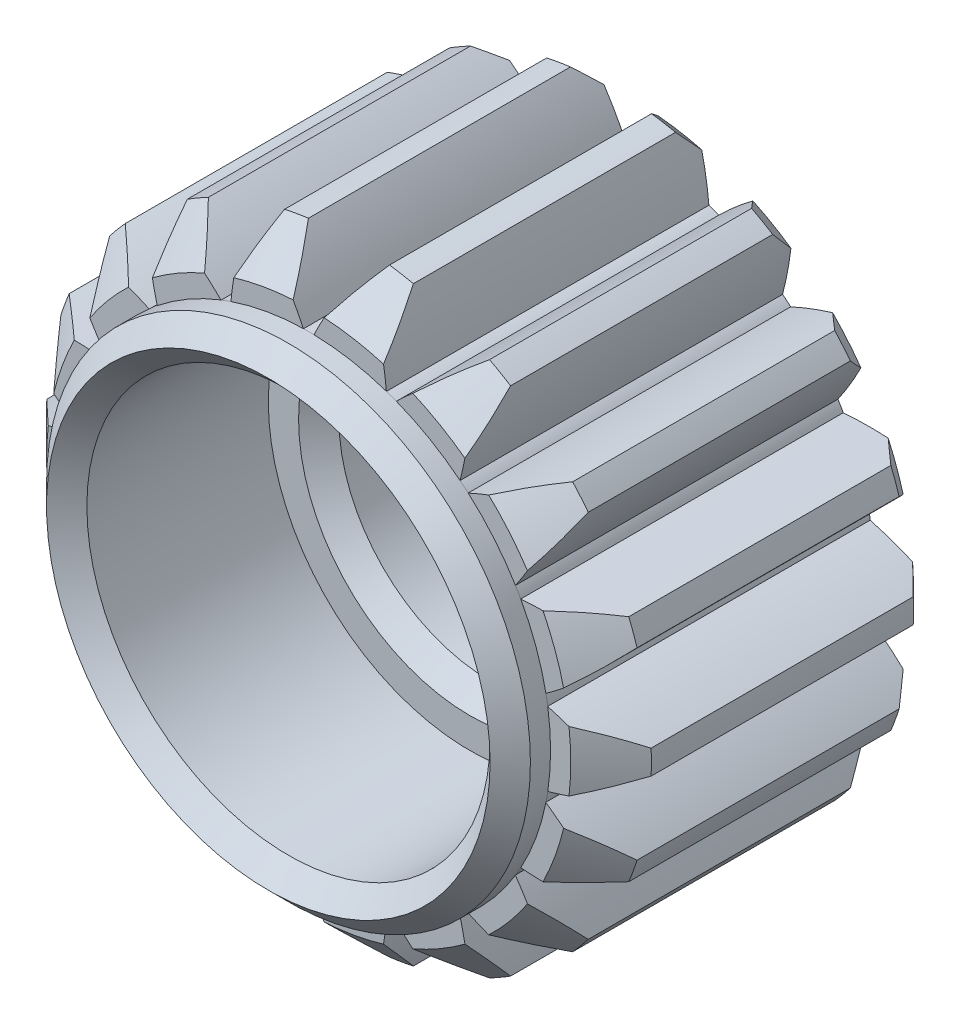
from build123d import *

# Parameters (mm, degrees)
SKETCH1_R           = 7.5
BOSS_EXTRUDE1_DEPTH = 4
FRONT_CHAMFER_SIZE  = 1
REAR_CHAMFER_SIZE   = 0.5
CUT_EXTRUDE1_DEPTH  = 14.285330256
CIRPATTERN1_COUNT   = 18
SKETCH3_R           = 6
BOSS_EXTRUDE2_DEPTH = 1
CHAMFER3_SIZE       = 0.5
SKETCH4_R           = 5
CUT_EXTRUDE2_DEPTH  = 5
SKETCH5_R           = 3.75
CUT_EXTRUDE3_DEPTH  = 12.682901447
CHAMFER4_SIZE       = 0.5
CHAMFER5_SIZE       = 2


with BuildPart() as part:
    # Sketch1 → Boss-Extrude1 (new, symmetric)
    with BuildSketch(Plane.XY):
        Circle(SKETCH1_R)
    extrude(amount=BOSS_EXTRUDE1_DEPTH, both=True)

    # Front Chamfer
    front_chamfer_edges = [part.edges().sort_by_distance(p)[0] for p in [
        (-7.5, 0, 4),
    ]]
    chamfer(front_chamfer_edges, length=FRONT_CHAMFER_SIZE)

    # Rear Chamfer
    rear_chamfer_edges = [part.edges().sort_by_distance(p)[0] for p in [
        (-7.5, 0, -4),
    ]]
    chamfer(rear_chamfer_edges, length=REAR_CHAMFER_SIZE)

    # Sketch2 → Cut-Extrude1 (cut, through all)
    with BuildSketch(Plane.XY.offset(4)):
        with BuildLine():
            ThreePointArc((-1.004896391, 7.432373998), (0, 7.5), (1.004896391, 7.432373998))
            ThreePointArc((1.004896391, 7.432373998), (0.529926002, 6.736378953), (0.130795799, 5.994286605))
            ThreePointArc((0.130795799, 5.994286605), (0, 6), (-0.130795799, 5.994286605))
            ThreePointArc((-0.130795799, 5.994286605), (-0.529926002, 6.736378953), (-1.004896391, 7.432373998))
        make_face()
    cut_extrude1 = extrude(amount=-CUT_EXTRUDE1_DEPTH, mode=Mode.SUBTRACT)

    # CirPattern1: Cut-Extrude1 ×18 about axis
    cirpattern1_axis = Axis((0, 0, 0), (0, 0, 1))
    for i in range(1, CIRPATTERN1_COUNT):
        add(cut_extrude1.rotate(cirpattern1_axis, i * 360 / CIRPATTERN1_COUNT), mode=Mode.SUBTRACT)

    # Sketch3 → Boss-Extrude2 (add)
    with BuildSketch(Plane.XY.offset(4)):
        with Locations(Location((0, 0, 0), (0, 0, 188.731758123))):
            Circle(SKETCH3_R)
    extrude(amount=BOSS_EXTRUDE2_DEPTH)

    # Chamfer3
    chamfer3_edges = [part.edges().sort_by_distance(p)[0] for p in [
        (5.930459361, 0.910852219, 5),
    ]]
    chamfer(chamfer3_edges, length=CHAMFER3_SIZE)

    # Sketch4 → Cut-Extrude2 (cut)
    with BuildSketch(Plane.XY.offset(5)):
        Circle(SKETCH4_R)
    extrude(amount=-CUT_EXTRUDE2_DEPTH, mode=Mode.SUBTRACT)

    # Sketch5 → Cut-Extrude3 (cut, through all)
    with BuildSketch(Plane.XY):
        Circle(SKETCH5_R)
    extrude(amount=-CUT_EXTRUDE3_DEPTH, mode=Mode.SUBTRACT)

    # Chamfer4
    chamfer4_edges = [part.edges().sort_by_distance(p)[0] for p in [
        (-5, 0, 5),
        (-3.75, 0, 0),
    ]]
    chamfer(chamfer4_edges, length=CHAMFER4_SIZE - 0.0001)  # a hair under: the kernel refuses the full size

    # Chamfer5
    chamfer5_edges = [part.edges().sort_by_distance(p)[0] for p in [
        (-3.75, 0, -4),
    ]]
    chamfer(chamfer5_edges, length=CHAMFER5_SIZE)


solid = part.part
